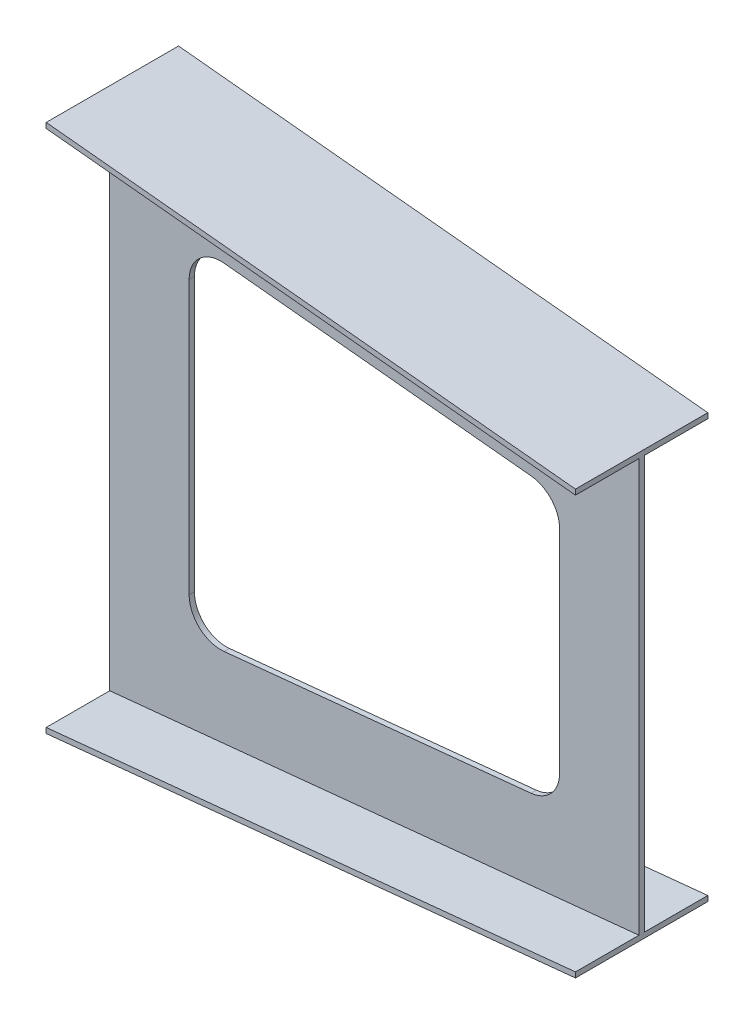
from build123d import *

# Parameters (mm, degrees)
CUT_EXTRUDE1_DEPTH = 10


with BuildPart() as part:
    # Sketch1 → Loft4 section 0
    with BuildSketch(Plane(origin=(0, 0, 0), x_dir=(0, 0, -1), z_dir=(1, 0, 0))):
        with BuildLine():
            Line((-130, 500), (120, 500))
            Line((120, 500), (120, 490))
            Line((120, 490), (0, 490))
            Line((0, 490), (0, -490))
            Line((0, -490), (120, -490))
            Line((120, -490), (120, -500))
            Line((120, -500), (-130, -500))
            Line((-130, -500), (-130, -490))
            Line((-130, -490), (-10, -490))
            Line((-10, -490), (-10, 490))
            Line((-10, 490), (-130, 490))
            Line((-130, 490), (-130, 500))
        make_face()
    # Sketch4 → Loft4 section 1
    with BuildSketch(Plane(origin=(1000, 0, -1000), x_dir=(0, 0, 1), z_dir=(-1, 0, 0))):
        with BuildLine():
            Line((880, 400), (1130, 400))
            Line((1130, 400), (1130, 390))
            Line((1130, 390), (1010, 390))
            Line((1010, 390), (1010, -390))
            Line((1010, -390), (1130, -390))
            Line((1130, -390), (1130, -400))
            Line((1130, -400), (880, -400))
            Line((880, -400), (880, -390))
            Line((880, -390), (1000, -390))
            Line((1000, -390), (1000, 390))
            Line((1000, 390), (880, 390))
            Line((880, 390), (880, 400))
        make_face()
    loft()

    # Sketch6 → Cut-Extrude1 (cut)
    with BuildSketch(Plane.XY.offset(10)):
        with BuildLine():
            Line((215.970223141, -317.654843369), (795.970223141, -259.654843369))
            ThreePointArc((795.970223141, -259.654843369), (834.487152013, -240.212931202), (850, -199.952611956))
            Line((850, -199.952611956), (850, 199.952611956))
            ThreePointArc((850, 199.952611956), (834.487152013, 240.212931202), (795.970223141, 259.654843369))
            Line((795.970223141, 259.654843369), (215.970223141, 317.654843369))
            ThreePointArc((215.970223141, 317.654843369), (169.739680754, 302.43976397), (150, 257.952611956))
            Line((150, 257.952611956), (150, -257.952611956))
            ThreePointArc((150, -257.952611956), (169.739680754, -302.43976397), (215.970223141, -317.654843369))
        make_face()
    extrude(amount=-CUT_EXTRUDE1_DEPTH, mode=Mode.SUBTRACT)


solid = part.part
